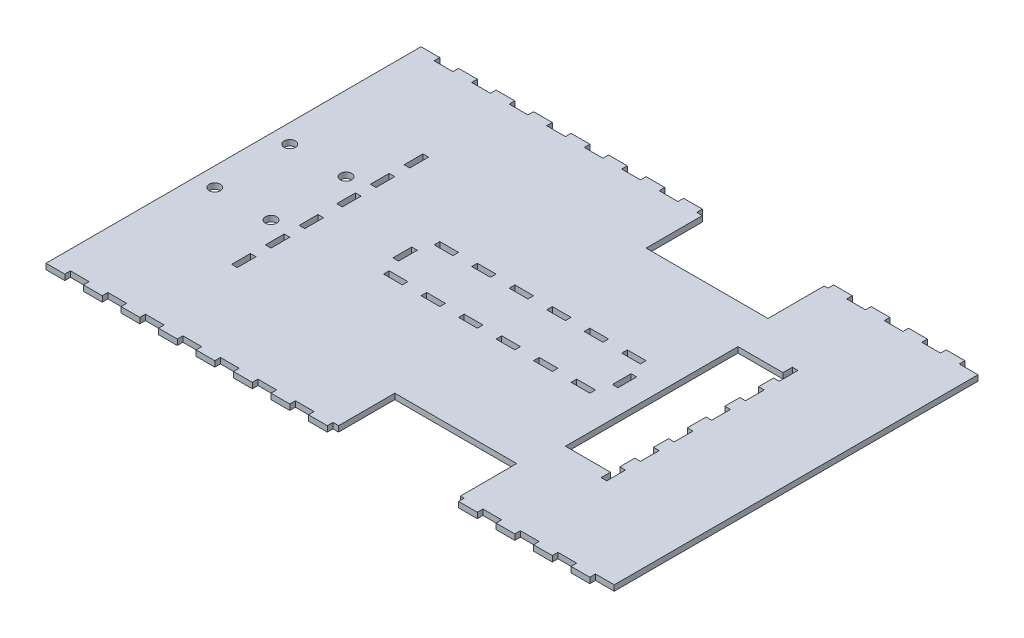
from build123d import *

# Parameters (mm, degrees)
SKETCH3_W           = 3
SKETCH3_H           = 10
SKETCH3_R           = 3
SKETCH3_W_2         = 10
SKETCH3_H_2         = 3
BOSS_EXTRUDE1_DEPTH = 3
SKETCH4_W           = 24
SKETCH4_H           = 92
CUT_EXTRUDE1_DEPTH  = 10
SKETCH5_W           = 65
SKETCH5_H           = 30
CUT_EXTRUDE2_DEPTH  = 10


with BuildPart() as part:
    # Sketch3 → Boss-Extrude1 (new body)
    with BuildSketch(Plane(origin=(0, 0, 0), x_dir=(1, 0, 0), z_dir=(0, 1, 0))):
        Polygon((-300, 97), (-300, -97), (-300, -100), (-290, -100), (-290, -97), (-280, -97), (-280, -100), (-270, -100), (-270, -97), (-260, -97), (-260, -100), (-250, -100), (-250, -97), (-240, -97), (-240, -100), (-230, -100), (-230, -97), (-220, -97), (-220, -100), (-210, -100), (-210, -97), (-200, -97), (-200, -100), (-190, -100), (-190, -97), (-180, -97), (-180, -100), (-170, -100), (-170, -97), (-160, -97), (-160, -100), (-150, -100), (-150, -97), (-140, -97), (-140, -100), (-130, -100), (-130, -97), (-120, -97), (-120, -100), (-110, -100), (-110, -97), (-100, -97), (-100, -100), (-90, -100), (-90, -97), (-80, -97), (-80, -100), (-70, -100), (-70, -97), (-60, -97), (-60, -100), (-50, -100), (-50, -97), (-40, -97), (-40, -100), (-30, -100), (-30, -97), (-20, -97), (-20, -100), (-10, -100), (-10, -97), (0, -97), (0, 97), (-10, 97), (-10, 100), (-20, 100), (-20, 97), (-30, 97), (-30, 100), (-40, 100), (-40, 97), (-50, 97), (-50, 100), (-60, 100), (-60, 97), (-70, 97), (-70, 100), (-80, 100), (-80, 97), (-90, 97), (-90, 100), (-100, 100), (-100, 97), (-110, 97), (-110, 100), (-120, 100), (-120, 97), (-130, 97), (-130, 100), (-140, 100), (-140, 97), (-150, 97), (-150, 100), (-160, 100), (-160, 97), (-170, 97), (-170, 100), (-180, 100), (-180, 97), (-190, 97), (-190, 100), (-200, 100), (-200, 97), (-210, 97), (-210, 100), (-220, 100), (-220, 97), (-230, 97), (-230, 100), (-240, 100), (-240, 97), (-250, 97), (-250, 100), (-260, 100), (-260, 97), (-270, 97), (-270, 100), (-280, 100), (-280, 97), (-290, 97), (-290, 100), (-300, 100), align=None)
        with Locations((-248.5, -46)):
            Rectangle(SKETCH3_W, SKETCH3_H, mode=Mode.SUBTRACT)
        with Locations((-248.5, -28)):
            Rectangle(SKETCH3_W, SKETCH3_H, mode=Mode.SUBTRACT)
        with Locations((-290, -20)):
            Circle(SKETCH3_R, mode=Mode.SUBTRACT)
        with Locations((-260, -20)):
            Circle(SKETCH3_R, mode=Mode.SUBTRACT)
        with Locations((-248.5, -10)):
            Rectangle(SKETCH3_W, SKETCH3_H, mode=Mode.SUBTRACT)
        with Locations((-200, -13.5)):
            Rectangle(SKETCH3_W_2, SKETCH3_H_2, mode=Mode.SUBTRACT)
        with Locations((-208.5, 0)):
            Rectangle(SKETCH3_W, SKETCH3_H, mode=Mode.SUBTRACT)
        with Locations((-180, -13.5)):
            Rectangle(SKETCH3_W_2, SKETCH3_H_2, mode=Mode.SUBTRACT)
        with Locations((-160, -13.5)):
            Rectangle(SKETCH3_W_2, SKETCH3_H_2, mode=Mode.SUBTRACT)
        with Locations((-140, -13.5)):
            Rectangle(SKETCH3_W_2, SKETCH3_H_2, mode=Mode.SUBTRACT)
        with Locations((-120, -13.5)):
            Rectangle(SKETCH3_W_2, SKETCH3_H_2, mode=Mode.SUBTRACT)
        with Locations((-100, -13.5)):
            Rectangle(SKETCH3_W_2, SKETCH3_H_2, mode=Mode.SUBTRACT)
        with Locations((-91.5, 0)):
            Rectangle(SKETCH3_W, SKETCH3_H, mode=Mode.SUBTRACT)
        with Locations((-51.5, -46)):
            Rectangle(SKETCH3_W, SKETCH3_H, mode=Mode.SUBTRACT)
        with Locations((-51.5, -28)):
            Rectangle(SKETCH3_W, SKETCH3_H, mode=Mode.SUBTRACT)
        with Locations((-51.5, -10)):
            Rectangle(SKETCH3_W, SKETCH3_H, mode=Mode.SUBTRACT)
        with Locations((-290, 20)):
            Circle(SKETCH3_R, mode=Mode.SUBTRACT)
        with Locations((-248.5, 10)):
            Rectangle(SKETCH3_W, SKETCH3_H, mode=Mode.SUBTRACT)
        with Locations((-260, 20)):
            Circle(SKETCH3_R, mode=Mode.SUBTRACT)
        with Locations((-248.5, 28)):
            Rectangle(SKETCH3_W, SKETCH3_H, mode=Mode.SUBTRACT)
        with Locations((-248.5, 46)):
            Rectangle(SKETCH3_W, SKETCH3_H, mode=Mode.SUBTRACT)
        with Locations((-200, 13.5)):
            Rectangle(SKETCH3_W_2, SKETCH3_H_2, mode=Mode.SUBTRACT)
        with Locations((-180, 13.5)):
            Rectangle(SKETCH3_W_2, SKETCH3_H_2, mode=Mode.SUBTRACT)
        with Locations((-160, 13.5)):
            Rectangle(SKETCH3_W_2, SKETCH3_H_2, mode=Mode.SUBTRACT)
        with Locations((-140, 13.5)):
            Rectangle(SKETCH3_W_2, SKETCH3_H_2, mode=Mode.SUBTRACT)
        with Locations((-120, 13.5)):
            Rectangle(SKETCH3_W_2, SKETCH3_H_2, mode=Mode.SUBTRACT)
        with Locations((-100, 13.5)):
            Rectangle(SKETCH3_W_2, SKETCH3_H_2, mode=Mode.SUBTRACT)
        with Locations((-51.5, 10)):
            Rectangle(SKETCH3_W, SKETCH3_H, mode=Mode.SUBTRACT)
        with Locations((-51.5, 28)):
            Rectangle(SKETCH3_W, SKETCH3_H, mode=Mode.SUBTRACT)
        with Locations((-51.5, 46)):
            Rectangle(SKETCH3_W, SKETCH3_H, mode=Mode.SUBTRACT)
    extrude(amount=BOSS_EXTRUDE1_DEPTH)

    # Sketch4 → Cut-Extrude1 (cut)
    with BuildSketch(Plane(origin=(0, 3, 0), x_dir=(1, 0, 0), z_dir=(0, 1, 0))):
        with Locations((-65, 0)):
            Rectangle(SKETCH4_W, SKETCH4_H)
    extrude(amount=-CUT_EXTRUDE1_DEPTH, mode=Mode.SUBTRACT)

    # Sketch5 → Cut-Extrude2 (cut)
    with BuildSketch(Plane(origin=(0, 3, 0), x_dir=(1, 0, 0), z_dir=(0, 1, 0))):
        with Locations((-114.5, 82)):
            Rectangle(SKETCH5_W, SKETCH5_H)
        with Locations((-114.5, -82)):
            Rectangle(SKETCH5_W, SKETCH5_H)
    extrude(amount=-CUT_EXTRUDE2_DEPTH, mode=Mode.SUBTRACT)


with BuildPart() as cut_extrude2_kept_piece:
    # of the separate pieces the step leaves, the one the design keeps (cut_extrude2_pieces_kept)
    add(part.part.solids().sort_by_distance((-300, 0, -100))[0])


solid = cut_extrude2_kept_piece.part
